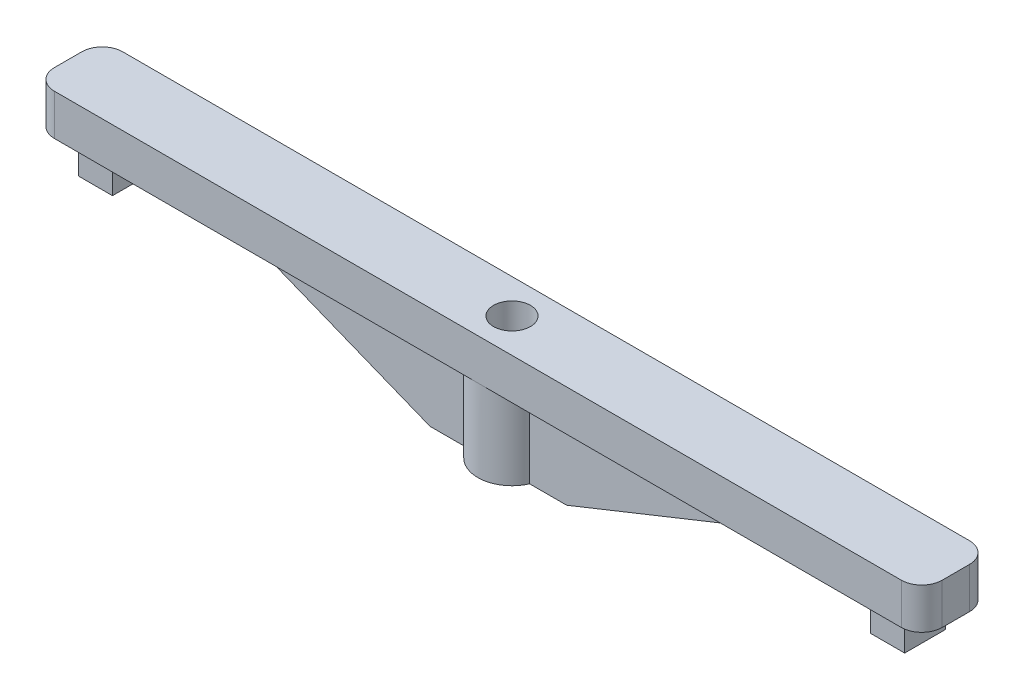
from build123d import *

# Parameters (mm, degrees)
SKETCH1_W                        = 65
SKETCH1_H                        = 5
BODY_DEPTH                       = 3
SKETCH3_W                        = 2.5
SKETCH3_H                        = 3
PEGS_DEPTH                       = 2.5
WEB_DEPTH                        = 1
SKETCH6_R                        = 2.5
HOLE_BOSS_DEPTH                  = 6
M2_5_CLEARANCE_HOLE1_D           = 2.7
M2_5_CLEARANCE_HOLE1_CSINK_D     = 3.5
M2_5_CLEARANCE_HOLE1_CSINK_ANGLE = 90
FILLET1_R                        = 1.5
FILLET2_R                        = 1
FILLET3_R                        = 1


with BuildPart() as part:
    # Sketch1 → body (new body)
    with BuildSketch(Plane(origin=(0, 0, 0), x_dir=(1, 0, 0), z_dir=(0, 1, 0))):
        Rectangle(SKETCH1_W, SKETCH1_H)
    extrude(amount=BODY_DEPTH)

    # Sketch3 → pegs (add)
    with BuildSketch(Plane.XZ):
        with Locations((29, 0)):
            Rectangle(SKETCH3_W, SKETCH3_H)
        with Locations((-29, 0)):
            Rectangle(SKETCH3_W, SKETCH3_H)
    extrude(amount=PEGS_DEPTH)

    # Sketch5 → web (add, symmetric)
    with BuildSketch(Plane.XY):
        Polygon((-20, 0), (20, 0), (5, -6), (-5, -6), align=None)
    extrude(amount=WEB_DEPTH, both=True)

    # Sketch6 → hole-boss (add)
    with BuildSketch(Plane.XZ):
        Circle(SKETCH6_R)
    extrude(amount=HOLE_BOSS_DEPTH)

    # M2.5 Clearance Hole1 (through all)
    with Locations(Plane(origin=(0, -6, 0), x_dir=(-1, 0, 0), z_dir=(0, -1, 0))):
        with Locations((0, 0)):
            CounterSinkHole(M2_5_CLEARANCE_HOLE1_D / 2, M2_5_CLEARANCE_HOLE1_CSINK_D / 2, counter_sink_angle=M2_5_CLEARANCE_HOLE1_CSINK_ANGLE)

    # Fillet1
    fillet1_edges = [part.edges().sort_by_distance(p)[0] for p in [
        (32.5, 1.5, 2.5),
        (-32.5, 1.5, 2.5),
        (-32.5, 1.5, -2.5),
        (32.5, 1.5, -2.5),
    ]]
    fillet(fillet1_edges, radius=FILLET1_R)

    # Fillet2
    fillet2_edges = [part.edges().sort_by_distance(p)[0] for p in [
        (29, 0, 1.5),
        (29, 0, -1.5),
        (-29, 0, 1.5),
        (-29, 0, -1.5),
    ]]
    fillet(fillet2_edges, radius=FILLET2_R - 0.0001)  # a hair under: the kernel refuses the full size

    # Fillet3
    fillet3_edges = [part.edges().sort_by_distance(p)[0] for p in [
        (11.145643924, 0, -1),
        (11.145643924, 0, 1),
        (-11.145643924, 0, -1),
        (-11.145643924, 0, 1),
    ]]
    fillet(fillet3_edges, radius=FILLET3_R)


solid = part.part
